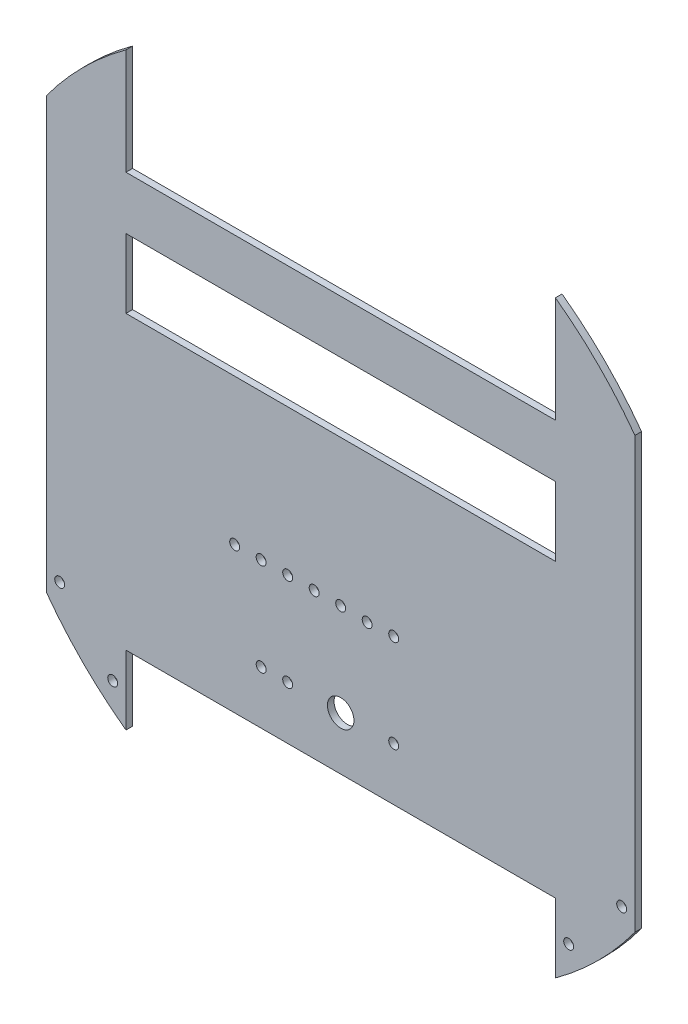
from build123d import *

# Parameters (mm, degrees)
SKETCH1_R               = 2.38125
BOSS_EXTRUDE1_DEPTH     = 3.175
BOSS_EXTRUDE2_DEPTH     = 50.8
CUT_EXTRUDE1_DEPTH      = 209.526843613
CUT_EXTRUDE1_DEPTH_BACK = 209.526843613
SKETCH3_R               = 203.829254644
SKETCH3_R_2             = 174.625
SKETCH5_R               = 2.38125
CUT_EXTRUDE3_DEPTH      = 200.484174202
SKETCH6_W               = 205.731089426
SKETCH6_H               = 25.4
BOSS_EXTRUDE3_DEPTH     = 3.175
SKETCH8_R               = 2.38125
CUT_EXTRUDE5_DEPTH      = 200.484174202
SKETCH9_W               = 205.731089426
SKETCH9_H               = 38.1
BOSS_EXTRUDE4_DEPTH     = 3.175
SKETCH10_R              = 6.35
SKETCH10_R_2            = 2.38125
CUT_EXTRUDE6_DEPTH      = 200.484174202


with BuildPart() as part:
    # Sketch1 → Boss-Extrude1 (new body)
    with BuildSketch(Plane.XY):
        with BuildLine():
            Line((-102.865544713, 31.75), (-102.865544713, 145.022480019))
            ThreePointArc((-102.865544713, 145.022480019), (-123.286100955, 128.114703728), (-140.965544713, 108.358457002))
            Line((-140.965544713, 108.358457002), (-140.965544713, -108.358457002))
            ThreePointArc((-140.965544713, -108.358457002), (-123.286100955, -128.114703728), (-102.865544713, -145.022480019))
            Line((-102.865544713, -145.022480019), (-102.865544713, -69.85))
            Line((-102.865544713, -69.85), (102.865544713, -69.85))
            Line((102.865544713, -69.85), (102.865544713, -145.022480019))
            ThreePointArc((102.865544713, -145.022480019), (123.286100955, -128.114703728), (140.965544713, -108.358457002))
            Line((140.965544713, -108.358457002), (140.965544713, 108.358457002))
            ThreePointArc((140.965544713, 108.358457002), (123.286100955, 128.114703728), (102.865544713, 145.022480019))
            Line((102.865544713, 145.022480019), (102.865544713, 31.75))
            Line((102.865544713, 31.75), (-102.865544713, 31.75))
        make_face()
        with Locations((25.4, -38.1)):
            Circle(SKETCH1_R, mode=Mode.SUBTRACT)
        with Locations((0, -38.1)):
            Circle(SKETCH1_R, mode=Mode.SUBTRACT)
        with Locations((-25.4, -38.1)):
            Circle(SKETCH1_R, mode=Mode.SUBTRACT)
    extrude(amount=BOSS_EXTRUDE1_DEPTH)

    # Sketch2 → Boss-Extrude2 (add)
    with BuildSketch(Plane.XY.offset(3.175)):
        with BuildLine():
            ThreePointArc((-102.865544713, -141.111907137), (-123.390730203, -123.566250752), (-140.965544713, -103.06602655))
            Line((-140.965544713, -103.06602655), (-140.965544713, -108.358457002))
            ThreePointArc((-140.965544713, -108.358457002), (-123.286100955, -128.114703728), (-102.865544713, -145.022480019))
            Line((-102.865544713, -145.022480019), (-102.865544713, -141.111907137))
        make_face()
        with BuildLine():
            ThreePointArc((140.965544713, -103.06602655), (123.390730203, -123.566250752), (102.865544713, -141.111907137))
            Line((102.865544713, -141.111907137), (102.865544713, -145.022480019))
            ThreePointArc((102.865544713, -145.022480019), (123.286100955, -128.114703728), (140.965544713, -108.358457002))
            Line((140.965544713, -108.358457002), (140.965544713, -103.06602655))
        make_face()
    extrude(amount=BOSS_EXTRUDE2_DEPTH)

    # Sketch3 → Cut-Extrude1 (cut, two sides: drawn at the far end of the back side and taken through both)
    with BuildSketch(Plane.XY.offset(3.175).offset(-CUT_EXTRUDE1_DEPTH_BACK)):
        Circle(SKETCH3_R)
        Circle(SKETCH3_R_2, mode=Mode.SUBTRACT)
    extrude(amount=CUT_EXTRUDE1_DEPTH + CUT_EXTRUDE1_DEPTH_BACK, mode=Mode.SUBTRACT)

    # Sketch5 → Cut-Extrude3 (cut, through all)
    with BuildSketch(Plane.XY.offset(3.175)):
        with Locations((134.615544713, -95.585904409)):
            Circle(SKETCH5_R)
        with Locations((109.215544713, -123.814275401)):
            Circle(SKETCH5_R)
        with Locations((-134.615544713, -95.585904409)):
            Circle(SKETCH5_R)
        with Locations((-109.215544713, -123.814275401)):
            Circle(SKETCH5_R)
    extrude(amount=-CUT_EXTRUDE3_DEPTH, mode=Mode.SUBTRACT)

    # Sketch6 → Boss-Extrude3 (add)
    with BuildSketch(Plane.XY.offset(3.175)):
        with Locations((0, 77.611907137)):
            Rectangle(SKETCH6_W, SKETCH6_H)
    extrude(amount=-BOSS_EXTRUDE3_DEPTH)

    # Sketch8 → Cut-Extrude5 (cut, through all)
    with BuildSketch(Plane.XY.offset(3.175)):
        with Locations((-38.1, -38.1)):
            Circle(SKETCH8_R)
        with Locations((-50.8, -38.1)):
            Circle(SKETCH8_R)
        with Locations((12.688397185, -38.642749361)):
            Circle(SKETCH8_R)
        with Locations((-12.7, -38.1)):
            Circle(SKETCH8_R)
    extrude(amount=-CUT_EXTRUDE5_DEPTH, mode=Mode.SUBTRACT)

    # Sketch9 → Boss-Extrude4 (add)
    with BuildSketch(Plane.XY.offset(3.175)):
        with Locations((0, -88.9)):
            Rectangle(SKETCH9_W, SKETCH9_H)
    extrude(amount=-BOSS_EXTRUDE4_DEPTH)

    # Sketch10 → Cut-Extrude6 (cut, through all)
    with BuildSketch(Plane.XY.offset(3.175)):
        with Locations((0, -82.55)):
            Circle(SKETCH10_R)
        with Locations((-25.4, -82.55)):
            Circle(SKETCH10_R_2)
        with Locations((-38.1, -82.55)):
            Circle(SKETCH10_R_2)
        with Locations((25.4, -82.55)):
            Circle(SKETCH10_R_2)
    extrude(amount=-CUT_EXTRUDE6_DEPTH, mode=Mode.SUBTRACT)


solid = part.part
